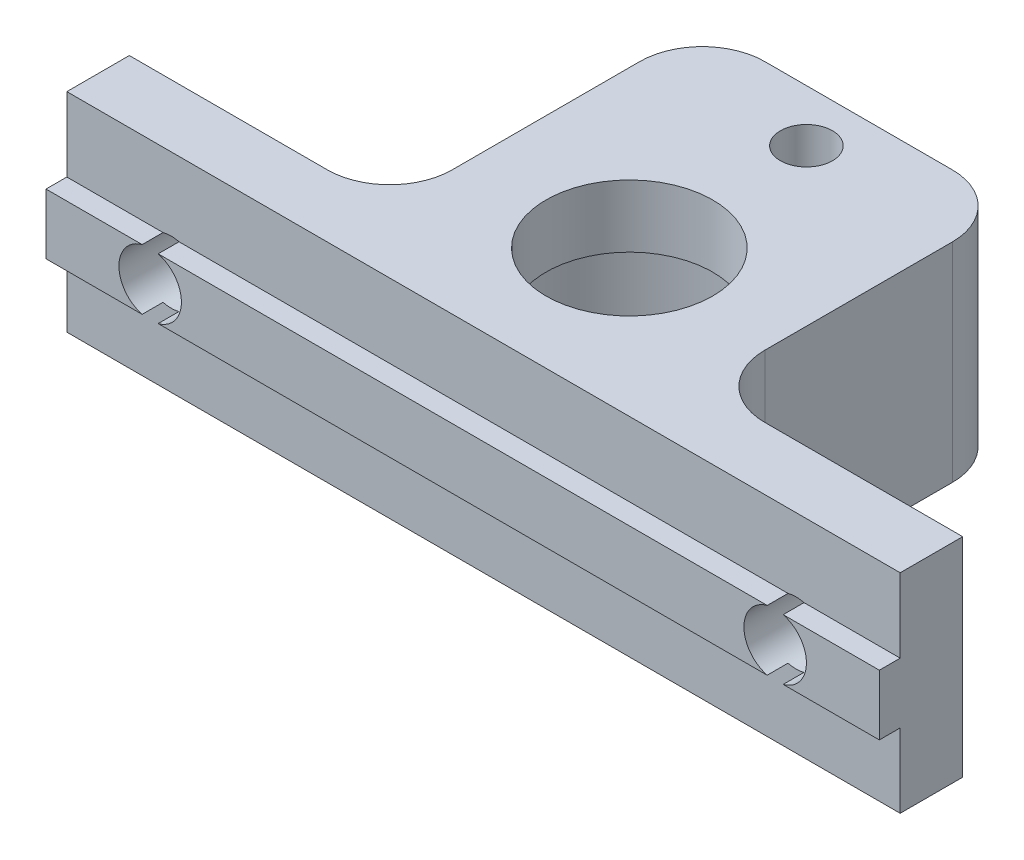
from build123d import *

# Parameters (mm, degrees)
ESQUISSE1_W                = 40
ESQUISSE1_H                = 10
MAIN_DEPTH                 = 3
ESQUISSE2_W                = 40
ESQUISSE2_H                = 2.9
MAKERBEAMRAIL_DEPTH        = 1
ESQUISSE3_R                = 1.5
MAKERBEAMHOLE_DEPTH        = 23.715633383
R_P_TITION_LIN_AIRE1_COUNT = 2
R_P_TITION_LIN_AIRE1_PITCH = 30
SKETCH3_W                  = 15
SKETCH3_H                  = 15
MAGNETSUPPORT_DEPTH        = 10
FILLET5_R                  = 3
SKETCH4_R                  = 6.25
MAGNETBIGHOLE_DEPTH        = 7
SKETCH5_R                  = 4
MAGNETSMALLHOLE_DEPTH      = 26.961509971
SKETCH6_R                  = 1.25
SUBMAGNETFIXHOLE_DEPTH     = 27.925824036


with BuildPart() as part:
    # Esquisse1 → Main (new body)
    with BuildSketch(Plane.XY):
        with Locations((0, 5)):
            Rectangle(ESQUISSE1_W, ESQUISSE1_H)
    extrude(amount=MAIN_DEPTH)

    # Esquisse2 → MakerBeamRail (add)
    with BuildSketch(Plane.XY.offset(3)):
        with Locations((0, 5)):
            Rectangle(ESQUISSE2_W, ESQUISSE2_H)
    extrude(amount=MAKERBEAMRAIL_DEPTH)

    # Esquisse3 → MakerBeamHole (cut, through all)
    with BuildSketch(Plane(origin=(0, 0, 0), x_dir=(-1, 0, 0), z_dir=(0, 0, -1))):
        with Locations((-15, 5)):
            Circle(ESQUISSE3_R)
    makerbeamhole = extrude(amount=-MAKERBEAMHOLE_DEPTH, mode=Mode.SUBTRACT)

    # Répétition linéaire1: MakerBeamHole ×2
    with Locations(*[(-i * R_P_TITION_LIN_AIRE1_PITCH, 0, 0) for i in range(1, R_P_TITION_LIN_AIRE1_COUNT)]):
        add(makerbeamhole, mode=Mode.SUBTRACT)

    # Sketch3 → MagnetSupport (add)
    with BuildSketch(Plane(origin=(0, 0, 0), x_dir=(1, 0, 0), z_dir=(0, 1, 0))):
        with Locations((0, 7.5)):
            Rectangle(SKETCH3_W, SKETCH3_H)
    extrude(amount=MAGNETSUPPORT_DEPTH)

    # Fillet5
    fillet5_edges = [part.edges().sort_by_distance(p)[0] for p in [
        (7.5, 5, 0),
        (-7.5, 5, 0),
        (-7.5, 5, -15),
        (7.5, 5, -15),
    ]]
    fillet(fillet5_edges, radius=FILLET5_R)

    # Sketch4 → MagnetBigHole (cut)
    with BuildSketch(Plane.XZ):
        with Locations((0, -4)):
            Circle(SKETCH4_R)
    extrude(amount=-MAGNETBIGHOLE_DEPTH, mode=Mode.SUBTRACT)

    # Sketch5 → MagnetSmallHole (cut, through all)
    with BuildSketch(Plane.XZ.offset(-7)):
        with Locations((0, -4)):
            Circle(SKETCH5_R)
    extrude(amount=-MAGNETSMALLHOLE_DEPTH, mode=Mode.SUBTRACT)

    # Sketch6 → SubMagnetFixHole (cut, through all)
    with BuildSketch(Plane(origin=(0, 10, 0), x_dir=(1, 0, 0), z_dir=(0, 1, 0))):
        with Locations((0, 12.5)):
            Circle(SKETCH6_R)
    extrude(amount=-SUBMAGNETFIXHOLE_DEPTH, mode=Mode.SUBTRACT)


solid = part.part
